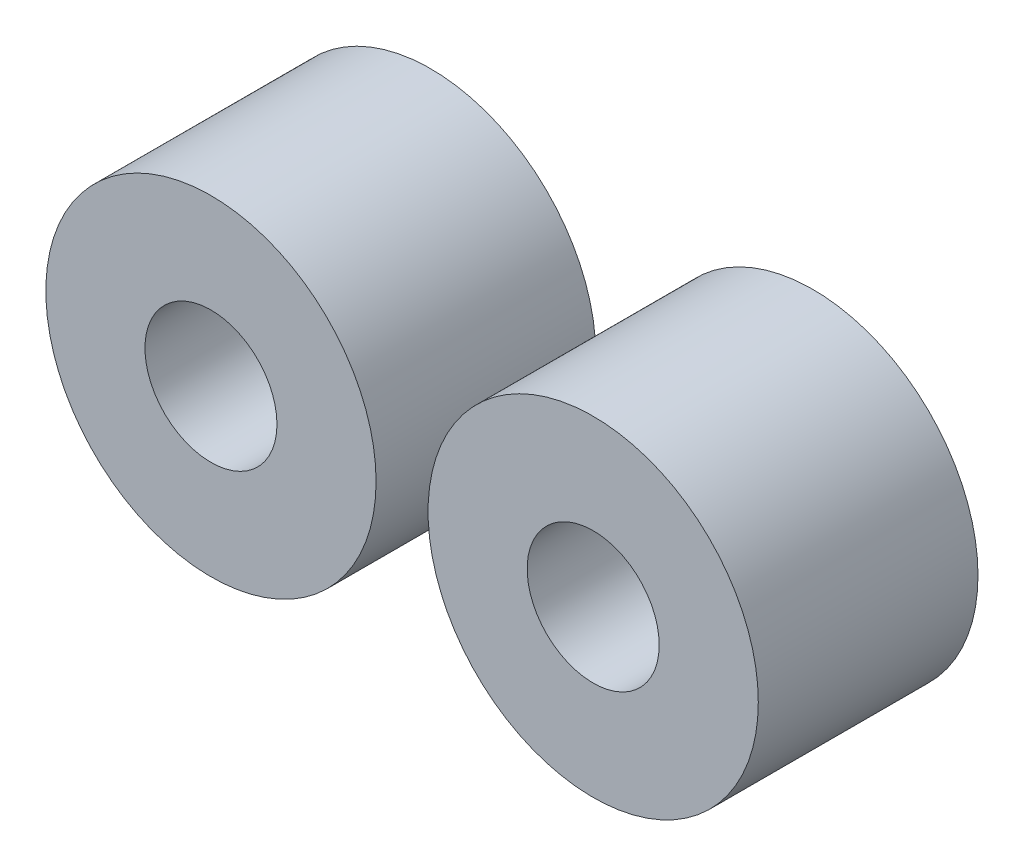
from build123d import *

# Parameters (mm, degrees)
SZKIC1_R                      = 953
SZKIC1_R_2                    = 381
DODANIE_WYCI_GNI_CIE1_DEPTH   = 1268
DODANIE_WYCI_GNI_CIE1_2_DEPTH = 1268


with BuildPart() as part:
    # Szkic1 → Dodanie-wyciągnięcie1 (new body)
    with BuildSketch(Plane.XY):
        Circle(SZKIC1_R)
        Circle(SZKIC1_R_2, mode=Mode.SUBTRACT)
    extrude(amount=DODANIE_WYCI_GNI_CIE1_DEPTH)


with BuildPart() as body_2:
    # Szkic1 → Dodanie-wyci_gni_cie1 2 (new body)
    with BuildSketch(Plane.XY):
        with Locations((2206, 0)):
            Circle(SZKIC1_R)
        with Locations((2206, 0)):
            Circle(SZKIC1_R_2, mode=Mode.SUBTRACT)
    extrude(amount=DODANIE_WYCI_GNI_CIE1_2_DEPTH)


solid = Compound([part.part, body_2.part])
